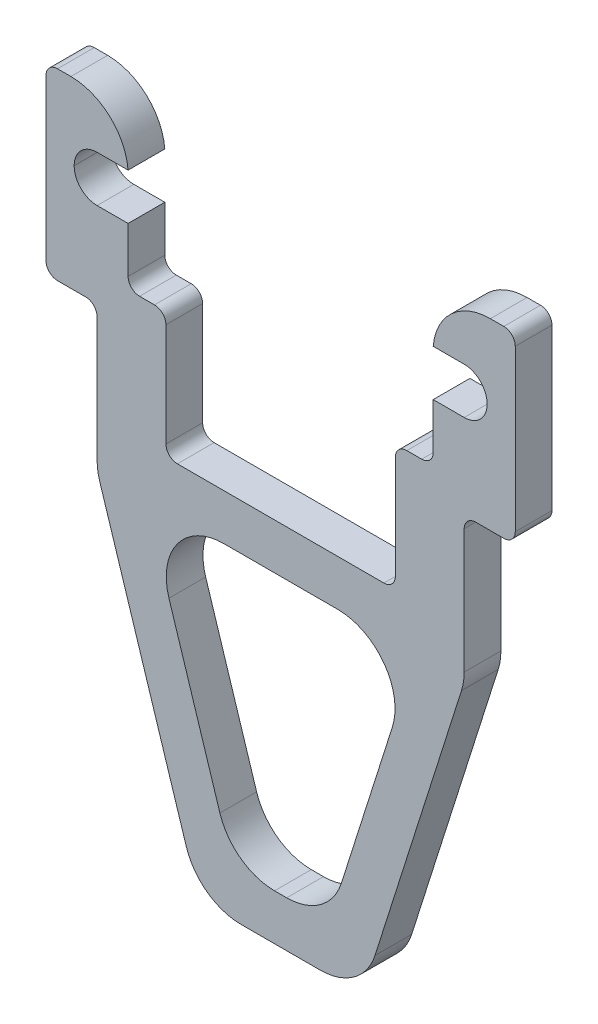
from build123d import *

# Parameters (mm, degrees)
BOSS_EXTRUDE1_DEPTH = 1.6
FILLET7_R           = 0.5
FILLET8_R           = 2.5
FILLET9_R           = 2.5
MIRROR1_DEPTH       = 1.6
FILLET10_R          = 1


# Read off the part's stored shape, not the designer's step: Mirror1
with BuildPart() as part:
    # Sketch1 → Boss-Extrude1 (new body)
    with BuildSketch(Plane.XY):
        Polygon((5, 16), (0, 16), (0, 14), (5.901749013, 14), (2.094432467, 2), (0, 2), (0, 0), (3.558130696, 0), (8, 14), (8, 20.3), (10.226542067, 20.3), (10.226542067, 28.3), (6.6499, 28.3), (6.6499, 26.01), (9, 26.01), (9, 24), (6.6499, 24), (6.6499, 21.5), (5, 21.5), align=None)
    extrude(amount=BOSS_EXTRUDE1_DEPTH)

    # Fillet7
    fillet7_edges = [part.edges().sort_by_distance(p)[0] for p in [
        (5, 16, 0.8),
        (5, 21.5, 0.8),
        (6.6499, 21.5, 0.8),
        (10.226542067, 28.3, 0.8),
        (10.226542067, 20.3, 0.8),
        (8, 20.3, 0.8),
    ]]
    fillet(fillet7_edges, radius=FILLET7_R)

    # Fillet8
    # the kernel refuses this fillet: 2.5 mm, written as the material it takes off along each edge
    with BuildSketch(Plane(origin=(6.6499, 28.3, -6.227910966), x_dir=(0, -1, 0), z_dir=(0, 0, 1))) as fillet8_piece_1:
        with BuildLine():
            CenterArc((2.5, 2.491164386), FILLET8_R, 180, 85.181476567)
            Line((0, 2.491164386), (-0.05, 2.491164386))
            Line((-0.05, 2.491164386), (-0.05, 0))
            Line((-0.05, 0), (0, -0.05))
            ThreePointArc((0, -0.05), (1.145, -0.05), (2.2858, -0.049823288))
            Line((2.2858, -0.049823288), (2.29, 0))
        make_face()
    extrude(amount=14.055821932, mode=Mode.SUBTRACT)

    # Fillet9
    fillet9_edges = [part.edges().sort_by_distance(p)[0] for p in [
        (8, 14, 0.8),
        (3.558130696, 0, 0.8),
        (2.094432467, 2, 0.8),
        (5.901749013, 14, 0.8),
    ]]
    fillet(fillet9_edges, radius=FILLET9_R)

    # Mirror1 outline → Mirror1 (add)
    with BuildSketch(Plane.XY):
        with BuildLine():
            Line((0, 16), (-4.5, 16))
            ThreePointArc((-4.5, 16), (-4.853553391, 16.146446609), (-5, 16.5))
            Line((-5, 16.5), (-5, 21))
            ThreePointArc((-5, 21), (-5.146446609, 21.353553391), (-5.5, 21.5))
            Line((-5.5, 21.5), (-6.1499, 21.5))
            ThreePointArc((-6.1499, 21.5), (-6.503453391, 21.646446609), (-6.6499, 22))
            Line((-6.6499, 22), (-6.6499, 24))
            Line((-6.6499, 24), (-9, 24))
            Line((-9, 24), (-9, 26.01))
            Line((-9, 26.01), (-6.6499, 26.01))
            ThreePointArc((-6.6499, 26.01), (-7.449171955, 27.640516232), (-9.141064386, 28.3))
            Line((-9.141064386, 28.3), (-9.726542067, 28.3))
            ThreePointArc((-9.726542067, 28.3), (-10.080095458, 28.153553391), (-10.226542067, 27.8))
            Line((-10.226542067, 27.8), (-10.226542067, 20.8))
            ThreePointArc((-10.226542067, 20.8), (-10.080095458, 20.44644661), (-9.726542067, 20.3))
            Line((-9.726542067, 20.3), (-8.5, 20.3))
            ThreePointArc((-8.5, 20.3), (-8.146446609, 20.153553391), (-8, 19.8))
            Line((-8, 19.8), (-8, 14.38708754))
            ThreePointArc((-8, 14.38708754), (-7.970560929, 14.004558199), (-7.882937042, 13.631037905))
            Line((-7.882937042, 13.631037905), (-4.111444952, 1.743950364))
            ThreePointArc((-4.111444952, 1.743950364), (-3.204969205, 0.482560523), (-1.72850791, 0))
            Line((-1.72850791, 0), (0, 0))
            Line((0, 0), (0, 2))
            Line((0, 2), (-0.264809681, 2))
            ThreePointArc((-0.264809681, 2), (-1.741270976, 2.482560523), (-2.647746723, 3.743950364))
            Line((-2.647746723, 3.743950364), (-4.868681376, 10.743950364))
            ThreePointArc((-4.868681376, 10.743950364), (-4.503183811, 12.976461295), (-2.485744333, 14))
            Line((-2.485744333, 14), (0, 14))
            Line((0, 14), (0, 16))
        make_face()
    extrude(amount=MIRROR1_DEPTH)

    # Fillet10
    fillet10_edges = [part.edges().sort_by_distance(p)[0] for p in [
        (-9, 24, 0.8),
        (-9, 26.01, 0.8),
        (9, 24, 0.8),
        (9, 26.01, 0.8),
    ]]
    fillet(fillet10_edges, radius=FILLET10_R)


solid = part.part
